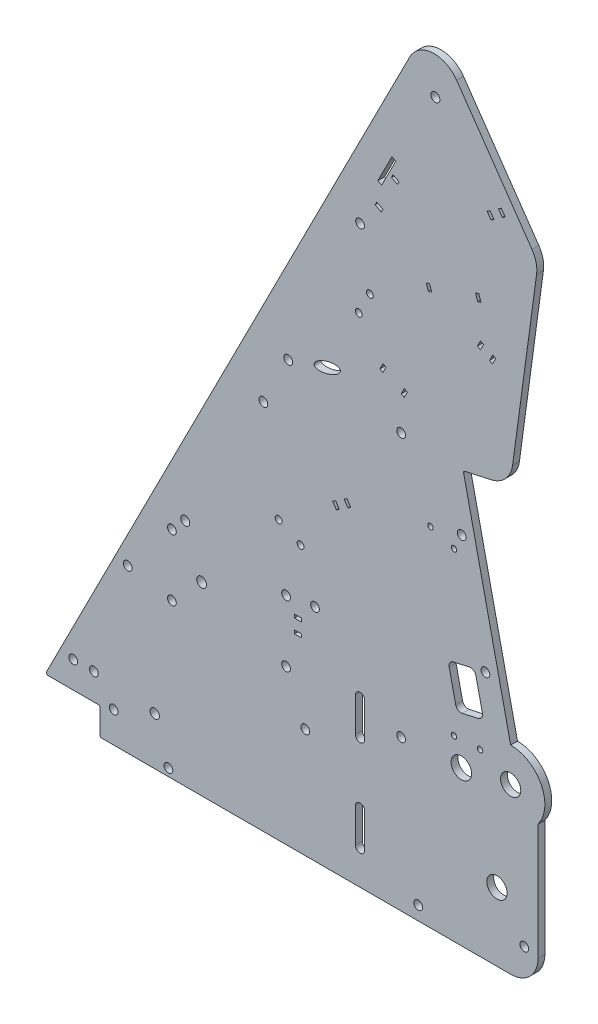
from build123d import *

# Parameters (mm, degrees)
BOSS_EXTRUDE1_DEPTH     = 3.175
SKETCH2_R               = 2.0955
SKETCH2_R_2             = 2.286
SKETCH2_R_3             = 2.032
SKETCH2_R_4             = 4.699
CUT_EXTRUDE1_DEPTH      = 421.976111717
SKETCH7_R               = 2.159
CUT_EXTRUDE2_DEPTH      = 421.976111717
CUT_EXTRUDE3_REACH      = 422.976
SKETCH10_R              = 2.032
FILLET1_R               = 12.7
FILLET2_R               = 0.79375
SKETCH12_R              = 2.032
CUT_EXTRUDE5_DEPTH      = 411.989226146
SKETCH13_R              = 2.032
SKETCH13_R_2            = 1.6
SKETCH13_RX             = 6.35
SKETCH13_RY             = 2.38125
SKETCH13_W              = 3.175
SKETCH13_H              = 1.5875
CUT_EXTRUDE6_DEPTH      = 411.989226146
CUT_EXTRUDE7_DEPTH      = 411.989226285
CUT_EXTRUDE7_DEPTH_BACK = 411.989226285
SKETCH14_R              = 1.27
SKETCH14_R_2            = 2.032
FILLET3_R               = 2.54
SKETCH15_R              = 4.7625
CUT_EXTRUDE8_DEPTH      = 411.989226285


with BuildPart() as part:
    # Sketch1 → Boss-Extrude1 (new body)
    with BuildSketch(Plane.XY):
        with BuildLine():
            Line((228.6, -12.7), (228.6, 53.975))
            ThreePointArc((228.6, 53.975), (230.099031657, 70.599515829), (215.9, 79.375))
            Line((215.9, 79.375), (193.909735224, 178.566674323))
            Line((193.909735224, 178.566674323), (215.607913982, 183.377044743))
            Line((215.607913982, 183.377044743), (228.6, 279.4))
            Line((228.6, 279.4), (178.754725958, 351.413083686))
            Line((178.754725958, 351.413083686), (0, 0))
            Line((0, 0), (25.4, 0))
            Line((25.4, 0), (25.4, -12.7))
            Line((25.4, -12.7), (228.6, -12.7))
        make_face()
    extrude(amount=BOSS_EXTRUDE1_DEPTH)

    # Sketch2 → Cut-Extrude1 (cut, through all)
    with BuildSketch(Plane.XY.offset(3.175)):
        with Locations((64.943150167, 94.057839899)):
            Circle(SKETCH2_R)
        with Locations((180.975, 322.164313376)):
            Circle(SKETCH2_R)
        with Locations((72.544547852, 73.173171402)):
            Circle(SKETCH2_R_2)
        with Locations((193.207821773, 152.394364194)):
            Circle(SKETCH2_R_3)
        with Locations((215.9, 63.5)):
            Circle(SKETCH2_R_4)
        with Locations((173.0375, -6.35)):
            Circle(SKETCH2_R_3)
        with Locations((204.202954161, 102.798527032)):
            Circle(SKETCH2_R_3)
        with Locations((209.55, 19.05)):
            Circle(SKETCH2_R_4)
        with Locations((165.1, 179.3875)):
            Circle(SKETCH2_R_3)
        with Locations((111.724047852, 87.460671402)):
            Circle(SKETCH2_R_3)
        with Locations((111.724047852, 58.885671402)):
            Circle(SKETCH2_R_3)
        with Locations((58.765047852, 58.885671402)):
            Circle(SKETCH2_R_3)
        with Locations((58.765047852, 87.460671402)):
            Circle(SKETCH2_R_3)
    extrude(amount=-CUT_EXTRUDE1_DEPTH, mode=Mode.SUBTRACT)

    # Sketch7 → Cut-Extrude2 (cut, through all)
    with BuildSketch(Plane.XY.offset(3.175)):
        with Locations((50.8, 9.525)):
            Circle(SKETCH7_R)
        with BuildLine():
            Line((143.891, 3.175), (143.891, 19.05))
            ThreePointArc((143.891, 19.05), (146.05, 21.209), (148.209, 19.05))
            Line((148.209, 19.05), (148.209, 3.175))
            ThreePointArc((148.209, 3.175), (146.05, 1.016), (143.891, 3.175))
        make_face()
        with BuildLine():
            Line((143.891, 47.625), (143.891, 63.5))
            ThreePointArc((143.891, 63.5), (146.05, 65.659), (148.209, 63.5))
            Line((148.209, 63.5), (148.209, 47.625))
            ThreePointArc((148.209, 47.625), (146.05, 45.466), (143.891, 47.625))
        make_face()
    extrude(amount=-CUT_EXTRUDE2_DEPTH, mode=Mode.SUBTRACT)

    # Sketch10 → Cut-Extrude3 (cut, up to next)
    with BuildSketch(Plane.XY.offset(3.175), mode=Mode.PRIVATE) as cut_extrude3_sk1:
        with Locations((120.65, 38.1)):
            Circle(SKETCH10_R)
    cut_extrude3_tool1 = extrude(cut_extrude3_sk1.sketch, amount=-CUT_EXTRUDE3_REACH, mode=Mode.PRIVATE) & part.part
    # Sketch10 → Cut-Extrude3 (cut, up to next)
    with BuildSketch(Plane.XY.offset(3.175), mode=Mode.PRIVATE) as cut_extrude3_sk2:
        with Locations((165.1, 57.15)):
            Circle(SKETCH10_R)
    cut_extrude3_tool2 = extrude(cut_extrude3_sk2.sketch, amount=-CUT_EXTRUDE3_REACH, mode=Mode.PRIVATE) & part.part
    # Sketch10 → Cut-Extrude3 (cut, up to next)
    with BuildSketch(Plane.XY.offset(3.175), mode=Mode.PRIVATE) as cut_extrude3_sk3:
        with Locations((13.046467246, 12.334704411)):
            Circle(SKETCH10_R)
    cut_extrude3_tool3 = extrude(cut_extrude3_sk3.sketch, amount=-CUT_EXTRUDE3_REACH, mode=Mode.PRIVATE) & part.part
    # Sketch10 → Cut-Extrude3 (cut, up to next)
    with BuildSketch(Plane.XY.offset(3.175), mode=Mode.PRIVATE) as cut_extrude3_sk4:
        with Locations((22.571467246, 12.334704411)):
            Circle(SKETCH10_R)
    cut_extrude3_tool4 = extrude(cut_extrude3_sk4.sketch, amount=-CUT_EXTRUDE3_REACH, mode=Mode.PRIVATE) & part.part
    # Sketch10 → Cut-Extrude3 (cut, up to next)
    with BuildSketch(Plane.XY.offset(3.175), mode=Mode.PRIVATE) as cut_extrude3_sk5:
        with Locations((38.261106384, 62.614550934)):
            Circle(SKETCH10_R)
    cut_extrude3_tool5 = extrude(cut_extrude3_sk5.sketch, amount=-CUT_EXTRUDE3_REACH, mode=Mode.PRIVATE) & part.part
    add(cut_extrude3_tool1.solids().sort_by_distance((120.65, 38.1, 3.175))[0], mode=Mode.SUBTRACT)
    add(cut_extrude3_tool2.solids().sort_by_distance((165.1, 57.15, 3.175))[0], mode=Mode.SUBTRACT)
    add(cut_extrude3_tool3.solids().sort_by_distance((13.046467, 12.334704, 3.175))[0], mode=Mode.SUBTRACT)
    add(cut_extrude3_tool4.solids().sort_by_distance((22.571467, 12.334704, 3.175))[0], mode=Mode.SUBTRACT)
    add(cut_extrude3_tool5.solids().sort_by_distance((38.261106, 62.614551, 3.175))[0], mode=Mode.SUBTRACT)

    # Fillet1
    fillet1_edges = [part.edges().sort_by_distance(p)[0] for p in [
        (228.6, -12.7, 1.5875),
        (178.754725958, 351.413083686, 1.5875),
        (215.607913982, 183.377044743, 1.5875),
        (228.6, 279.4, 1.5875),
    ]]
    fillet(fillet1_edges, radius=FILLET1_R)

    # Fillet2
    fillet2_edges = [part.edges().sort_by_distance(p)[0] for p in [
        (25.4, -12.7, 1.5875),
        (25.4, 0, 1.5875),
        (193.909735224, 178.566674323, 1.5875),
        (0, 0, 1.5875),
    ]]
    fillet(fillet2_edges, radius=FILLET2_R)

    # Sketch12 → Cut-Extrude5 (cut, through all)
    with BuildSketch(Plane.XY.offset(3.175)):
        with Locations((31.75, 1.5875)):
            Circle(SKETCH12_R)
        with Locations((173.0375, -6.35)):
            Circle(SKETCH12_R)
        with Locations((222.25, 1.5875)):
            Circle(SKETCH12_R)
        with Locations((57.15, -9.2075)):
            Circle(SKETCH12_R)
    extrude(amount=-CUT_EXTRUDE5_DEPTH, mode=Mode.SUBTRACT)

    # Sketch13 → Cut-Extrude6 (cut, through all)
    with BuildSketch(Plane.XY.offset(3.175)):
        with Locations((112.7125, 182.5625)):
            Circle(SKETCH13_R)
        with Locations((146.05, 254)):
            Circle(SKETCH13_R)
        with Locations((101.196445848, 159.923142748)):
            Circle(SKETCH13_R)
        with Locations((145.425401324, 217.737567137)):
            Circle(SKETCH13_R_2)
        with Locations((150.594024053, 227.898538502)):
            Circle(SKETCH13_R_2)
        with Locations((108.294003262, 116.150198589)):
            Circle(SKETCH13_R_2)
        with Locations((118.454974627, 110.981575859)):
            Circle(SKETCH13_R_2)
        with Locations(Location((130.826142263, 188.461522288), (0, 0, 18.038739462))):
            Ellipse(SKETCH13_RX, SKETCH13_RY)
        Polygon((178.26972852, 245.992253978), (176.758236028, 245.506922447), (177.728899089, 242.483937462), (179.240391581, 242.969268992), align=None)
        Polygon((160.847712251, 288.198438198), (154.283561384, 275.294004564), (156.066187939, 274.387228647), (162.630338806, 287.29166228), align=None)
        Polygon((200.609634347, 249.830809719), (202.12112684, 250.316141249), (201.150463779, 253.339126235), (199.638971286, 252.853794704), align=None)
        Polygon((160.590482388, 279.78010172), (163.420402045, 278.340594951), (164.140155429, 279.75555478), (161.310235773, 281.195061549), align=None)
        Polygon((153.789663007, 266.410402556), (153.069909623, 264.995442728), (155.899829279, 263.555935959), (156.619582664, 264.970895787), align=None)
        Polygon((203.330342332, 234.029927366), (201.915382504, 234.74968075), (200.475875735, 231.919761094), (201.890835563, 231.200007709), align=None)
        Polygon((206.135715047, 229.040747556), (207.550674876, 228.320994171), (208.990181645, 231.150913828), (207.575221816, 231.870667212), align=None)
        Polygon((211.540543439, 292.889033628), (210.235229039, 291.98553456), (212.042227175, 289.374905759), (213.347541575, 290.278404827), align=None)
        Polygon((206.319285837, 289.275037356), (205.013971437, 288.371538288), (206.820969573, 285.760909487), (208.126283974, 286.664408555), align=None)
        Polygon((133.35043444, 136.102010662), (135.081463368, 133.440401403), (136.412267998, 134.305915867), (134.681239069, 136.967525126), align=None)
        Polygon((155.228084113, 200.119678264), (156.643043941, 199.39992488), (158.08255071, 202.229844536), (156.667590882, 202.949597921), align=None)
        Polygon((165.132802911, 195.081404573), (166.547762739, 194.361651188), (167.987269508, 197.191570845), (166.57230968, 197.911324229), align=None)
        Polygon((140.404681887, 136.90245926), (138.673652958, 139.564068519), (140.004457588, 140.429582984), (141.735486516, 137.767973724), align=None)
        with Locations((117.248547852, 81.078921402)):
            Rectangle(SKETCH13_W, SKETCH13_H)
        with Locations((117.248547852, 74.728921402)):
            Rectangle(SKETCH13_W, SKETCH13_H)
    extrude(amount=-CUT_EXTRUDE6_DEPTH, mode=Mode.SUBTRACT)

    # Sketch14 → Cut-Extrude7 (cut, two sides: drawn at the far end of the back side and taken through both)
    with BuildSketch(Plane.XY.offset(3.175).offset(-CUT_EXTRUDE7_DEPTH_BACK)):
        with Locations((189.602197334, 69.980636704)):
            Circle(SKETCH14_R)
        with Locations((201.708862449, 70.509225118)):
            Circle(SKETCH14_R)
        with Locations((165.1, 57.15)):
            Circle(SKETCH14_R_2)
        with Locations((125.14977438, 89.522927623)):
            Circle(SKETCH14_R_2)
        with Locations((178.721644858, 148.532438598)):
            Circle(SKETCH14_R)
        with Locations((189.622629605, 145.09537131)):
            Circle(SKETCH14_R)
        Polygon((186.844411154, 98.950230697), (199.243370445, 101.699013794), (203.36654509, 83.100574858), (190.9675858, 80.351791761), align=None)
    extrude(amount=CUT_EXTRUDE7_DEPTH + CUT_EXTRUDE7_DEPTH_BACK, mode=Mode.SUBTRACT)

    # Fillet3
    fillet3_edges = [part.edges().sort_by_distance(p)[0] for p in [
        (199.243370445, 101.699013794, 1.5875),
        (186.844411154, 98.950230697, 1.5875),
        (190.9675858, 80.351791761, 1.5875),
        (203.36654509, 83.100574858, 1.5875),
    ]]
    fillet(fillet3_edges, radius=FILLET3_R)

    # Sketch15 → Cut-Extrude8 (cut, through all)
    with BuildSketch(Plane.XY.offset(3.175)):
        with Locations((193.04, 58.801)):
            Circle(SKETCH15_R)
    extrude(amount=-CUT_EXTRUDE8_DEPTH, mode=Mode.SUBTRACT)


solid = part.part
